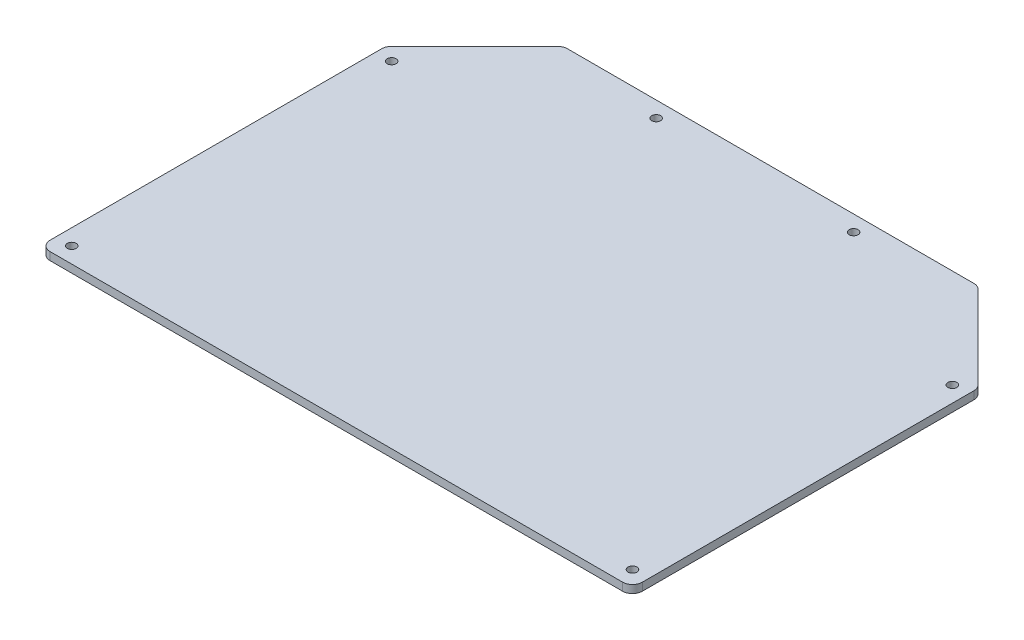
from build123d import *

# Parameters (mm, degrees)
MAIN_EXTRUSION_DEPTH = 4
CORNER_LEAVE_R       = 5
D_GAGEMENT_M41_D     = 4.5


with BuildPart() as part:
    # Main scetch → Main extrusion (new body)
    with BuildSketch(Plane(origin=(0, 0, 0), x_dir=(1, 0, 0), z_dir=(0, 1, 0))):
        Polygon((-150, 0), (150, 0), (150, 175), (105, 220), (-105, 220), (-150, 175), align=None)
    extrude(amount=MAIN_EXTRUSION_DEPTH)

    # Corner leave
    corner_leave_edges = [part.edges().sort_by_distance(p)[0] for p in [
        (-150, 2, 0),
        (150, 2, -175),
        (105, 2, -220),
        (150, 2, 0),
        (-105, 2, -220),
        (-150, 2, -175),
    ]]
    fillet(corner_leave_edges, radius=CORNER_LEAVE_R)

    # Dégagement M41 (through all)
    with Locations(Plane(origin=(0, 4, 0), x_dir=(1, 0, 0), z_dir=(0, 1, 0))):
        with Locations((-142, 8), (-142, 170), (-50, 212), (50, 212), (142, 170), (142, 8)):
            Hole(D_GAGEMENT_M41_D / 2)


solid = part.part
